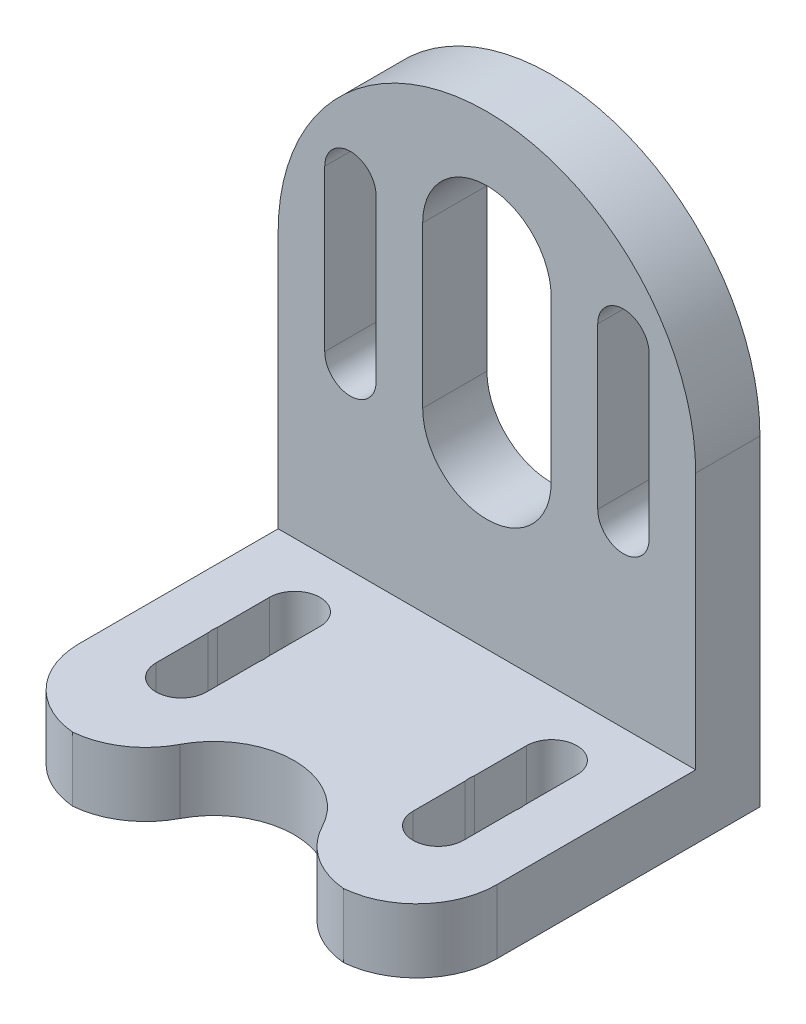
from build123d import *

# Parameters (mm, degrees)
SKETCH1_R           = 4
SKETCH1_R_2         = 1.6
BOSS_EXTRUDE1_DEPTH = 4
SKETCH2_W           = 26
SKETCH2_H           = 4
BOSS_EXTRUDE2_DEPTH = 33
SKETCH3_R           = 5
SKETCH3_R_2         = 1.6
CUT_EXTRUDE1_DEPTH  = 33
CUT_EXTRUDE2_DEPTH  = 33
CUT_EXTRUDE3_DEPTH  = 5
SKETCH7_W           = 26
SKETCH7_H           = 15.618281376
CUT_EXTRUDE4_DEPTH  = 5
FILLET1_R           = 5
CUT_EXTRUDE5_DEPTH  = 10


with BuildPart() as part:
    # Sketch1 → Boss-Extrude1 (new body)
    with BuildSketch(Plane.XY):
        with BuildLine():
            Line((13, -10), (-13, -10))
            Line((-13, -10), (-13, 10))
            ThreePointArc((-13, 10), (0, 23), (13, 10))
            Line((13, 10), (13, -10))
        make_face()
        with Locations((0, 10)):
            Circle(SKETCH1_R, mode=Mode.SUBTRACT)
        with Locations((-8.5, 10)):
            Circle(SKETCH1_R_2, mode=Mode.SUBTRACT)
        with Locations(Location((8.5, 10, 0), (0, 0, 180))):
            Circle(SKETCH1_R_2, mode=Mode.SUBTRACT)
    extrude(amount=BOSS_EXTRUDE1_DEPTH)

    # Sketch2 → Boss-Extrude2 (add)
    with BuildSketch(Plane.XY.offset(4)):
        with Locations((0, -8)):
            Rectangle(SKETCH2_W, SKETCH2_H)
    extrude(amount=BOSS_EXTRUDE2_DEPTH)

    # Sketch3 → Cut-Extrude1 (cut)
    with BuildSketch(Plane.XZ.offset(10)):
        with Locations((0, 21)):
            Circle(SKETCH3_R)
        with Locations((-8, 25.5)):
            Circle(SKETCH3_R_2)
        with Locations(Location((8, 25.5, 0), (0, 0, 270))):
            Circle(SKETCH3_R_2)
        with Locations((8, 11.5)):
            Circle(SKETCH3_R_2)
        with Locations(Location((-8, 11.5, 0), (0, 0, 270))):
            Circle(SKETCH3_R_2)
    extrude(amount=-CUT_EXTRUDE1_DEPTH, mode=Mode.SUBTRACT)

    # Sketch4 → Cut-Extrude2 (cut)
    with BuildSketch(Plane.XY.offset(4)):
        with BuildLine():
            Line((-10.1, 5), (-10.1, 15))
            ThreePointArc((-10.1, 15), (-8.5, 16.6), (-6.9, 15))
            Line((-6.9, 15), (-6.9, 5))
            ThreePointArc((-6.9, 5), (-8.5, 3.4), (-10.1, 5))
        make_face()
        with BuildLine():
            Line((10.1, 5), (10.1, 15))
            ThreePointArc((10.1, 15), (8.5, 16.6), (6.9, 15))
            Line((6.9, 15), (6.9, 5))
            ThreePointArc((6.9, 5), (8.5, 3.4), (10.1, 5))
        make_face()
    extrude(amount=-CUT_EXTRUDE2_DEPTH, mode=Mode.SUBTRACT)

    # Sketch6 → Cut-Extrude3 (cut)
    with BuildSketch(Plane(origin=(0, -6, 0), x_dir=(1, 0, 0), z_dir=(0, 1, 0))):
        with BuildLine():
            Line((6.42648755, -15.03229904), (6.42648755, -7.96770096))
            ThreePointArc((6.42648755, -7.96770096), (8, -6.39418851), (9.57351245, -7.96770096))
            Line((9.57351245, -7.96770096), (9.57351245, -15.03229904))
            ThreePointArc((9.57351245, -15.03229904), (8, -16.60581149), (6.42648755, -15.03229904))
        make_face()
        with BuildLine():
            Line((-6.42648755, -15.03229904), (-6.42648755, -7.96770096))
            ThreePointArc((-6.42648755, -7.96770096), (-8, -6.39418851), (-9.57351245, -7.96770096))
            Line((-9.57351245, -7.96770096), (-9.57351245, -15.03229904))
            ThreePointArc((-9.57351245, -15.03229904), (-8, -16.60581149), (-6.42648755, -15.03229904))
        make_face()
    extrude(amount=-CUT_EXTRUDE3_DEPTH, mode=Mode.SUBTRACT)

    # Sketch7 → Cut-Extrude4 (cut)
    with BuildSketch(Plane(origin=(0, -6, 0), x_dir=(1, 0, 0), z_dir=(0, 1, 0))):
        with Locations((0, -29.190859312)):
            Rectangle(SKETCH7_W, SKETCH7_H)
    extrude(amount=-CUT_EXTRUDE4_DEPTH, mode=Mode.SUBTRACT)

    # Fillet1
    # the kernel refuses this fillet: 5 mm, written as the material it takes off along each edge
    with BuildSketch(Plane(origin=(-13, 6.5, 21.381718624), x_dir=(0, 0, -1), z_dir=(0, -1, 0))) as fillet1_piece_1:
        with BuildLine():
            CenterArc((FILLET1_R, FILLET1_R), FILLET1_R, 180, 90)
            Line((0, FILLET1_R), (0, 0))
            Line((0, 0), (FILLET1_R, 0))
        make_face()
    extrude(amount=29, mode=Mode.SUBTRACT)
    with BuildSketch(Plane(origin=(13, 6.5, 21.381718624), x_dir=(0, 0, -1), z_dir=(0, -1, 0))) as fillet1_piece_2:
        with BuildLine():
            CenterArc((FILLET1_R, -FILLET1_R), FILLET1_R, 90, 90)
            Line((0, -FILLET1_R), (0, 0))
            Line((0, 0), (FILLET1_R, 0))
        make_face()
    extrude(amount=29, mode=Mode.SUBTRACT)
    with BuildSketch(Plane(origin=(4.985407796, 3.710716282, 21.381718624), x_dir=(-0.20045131167218372, 0, -0.9797036652217348), z_dir=(0, -1, 0))) as fillet1_piece_3:
        with BuildLine():
            CenterArc((4.119908, 4.807706292), FILLET1_R, 191.563351745, 62.494863063)
            Line((-0.778610326, 3.805449733), (0, 0))
            ThreePointArc((0, 0), (1.373302667, 0.192293708), (2.746605333, 0))
        make_face()
    extrude(amount=23.421432563, mode=Mode.SUBTRACT)
    with BuildSketch(Plane(origin=(-4.985407796, 3.710716282, 21.381718624), x_dir=(-1, 0, 0), z_dir=(0, -1, 0))) as fillet1_piece_4:
        with BuildLine():
            CenterArc((3.884286513, 5), FILLET1_R, 207.505136937, 62.494863063)
            ThreePointArc((-0.550560642, 2.690859312), (-0.08688947, 1.383975182), (0, 0))
            Line((0, 0), (3.884286513, 0))
        make_face()
    extrude(amount=23.421432563, mode=Mode.SUBTRACT)

    # Sketch8 → Cut-Extrude5 (cut)
    with BuildSketch(Plane(origin=(0, 0, 0), x_dir=(-1, 0, 0), z_dir=(0, 0, -1))):
        with BuildLine():
            Line((-4, 5), (-4, 15))
            ThreePointArc((-4, 15), (0, 19), (4, 15))
            Line((4, 15), (4, 5))
            ThreePointArc((4, 5), (0, 1), (-4, 5))
        make_face()
    extrude(amount=-CUT_EXTRUDE5_DEPTH, mode=Mode.SUBTRACT)


solid = part.part
